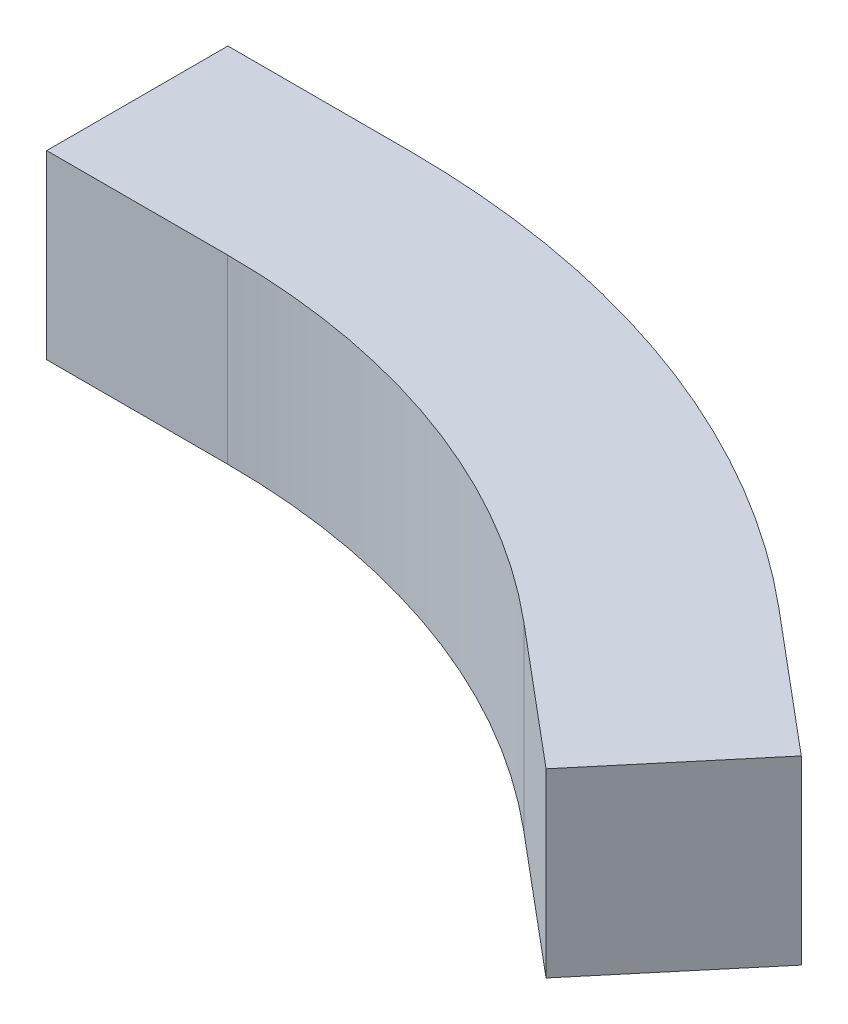
from build123d import *

# Parameters (mm, degrees)
BOSS_EXTRUDE1_DEPTH = 15


with BuildPart() as part:
    # Sketch1 → Boss-Extrude1 (new body)
    with BuildSketch(Plane(origin=(0, 0, 0), x_dir=(1, 0, 0), z_dir=(0, 1, 0))):
        with BuildLine():
            Line((-14.97, 60), (0, 60))
            ThreePointArc((0, 60), (20.5212086, 56.381557247), (38.567256581, 45.962666587))
            Line((38.567256581, 45.962666587), (50.034941895, 36.34013607))
            Line((50.034941895, 36.34013607), (59.67675604, 47.830802717))
            Line((59.67675604, 47.830802717), (48.209070726, 57.453333234))
            ThreePointArc((48.209070726, 57.453333234), (25.651510749, 70.476946559), (0, 75))
            Line((0, 75), (-14.97, 75))
            Line((-14.97, 75), (-14.97, 60))
        make_face()
    extrude(amount=BOSS_EXTRUDE1_DEPTH)


solid = part.part
